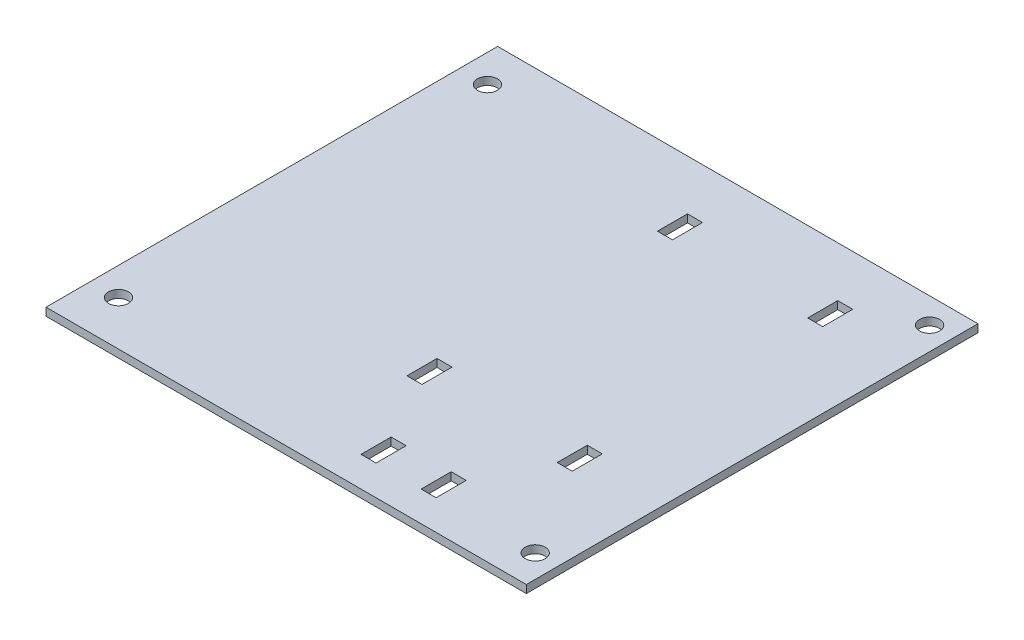
from build123d import *

# Parameters (mm, degrees)
SKETCH1_W               = 96.89
SKETCH1_H               = 90.17
PCB_DEPTH               = 1.57
SKETCH2_R               = 2
M3_MOUNTING_HOLES_DEPTH = 1.57
SKETCH5_W               = 0.5
SKETCH5_H               = 90.17
CUT_EXTRUDE1_DEPTH      = 127.49657684
SKETCH6_W               = 3
SKETCH6_H               = 6
ZIPTIE_HOLDS_DEPTH      = 10


with BuildPart() as part:
    # Sketch1 → PCB (new body)
    with BuildSketch(Plane(origin=(0, 0, 0), x_dir=(1, 0, 0), z_dir=(0, 1, 0))):
        with Locations((16.200949951, 63.633996534)):
            Rectangle(SKETCH1_W, SKETCH1_H)
    extrude(amount=PCB_DEPTH)

    # Sketch2 → M3 Mounting Holes (cut)
    with BuildSketch(Plane(origin=(0, 1.57, 0), x_dir=(1, 0, 0), z_dir=(0, 1, 0))):
        with Locations((59.565949951, 24.898996534)):
            Circle(SKETCH2_R)
        with Locations((-26.164050049, 27.438996534)):
            Circle(SKETCH2_R)
        with Locations((-26.164050049, 101.098996534)):
            Circle(SKETCH2_R)
        with Locations((59.565949951, 103.638996534)):
            Circle(SKETCH2_R)
    extrude(amount=-M3_MOUNTING_HOLES_DEPTH, mode=Mode.SUBTRACT)

    # Sketch5 → Cut-Extrude1 (cut, through all)
    with BuildSketch(Plane(origin=(0, 1.57, 0), x_dir=(1, 0, 0), z_dir=(0, 1, 0))):
        with Locations((-31.994050049, 63.633996534)):
            Rectangle(SKETCH5_W, SKETCH5_H)
        with Locations((64.395949951, 63.633996534)):
            Rectangle(SKETCH5_W, SKETCH5_H)
    extrude(amount=-CUT_EXTRUDE1_DEPTH, mode=Mode.SUBTRACT)

    # Sketch6 → ZipTie Holds (cut)
    with BuildSketch(Plane(origin=(0, 1.57, 0), x_dir=(1, 0, 0), z_dir=(0, 1, 0))):
        with Locations((17.645949951, 95.718996534)):
            Rectangle(SKETCH6_W, SKETCH6_H)
        with Locations((47.645949951, 95.718996534)):
            Rectangle(SKETCH6_W, SKETCH6_H)
        with Locations((17.645949951, 45.718996534)):
            Rectangle(SKETCH6_W, SKETCH6_H)
        with Locations((47.645949951, 45.718996534)):
            Rectangle(SKETCH6_W, SKETCH6_H)
        with Locations((26.645949951, 27.548996534)):
            Rectangle(SKETCH6_W, SKETCH6_H)
        with Locations((38.645949951, 27.548996534)):
            Rectangle(SKETCH6_W, SKETCH6_H)
    extrude(amount=-ZIPTIE_HOLDS_DEPTH, mode=Mode.SUBTRACT)


solid = part.part
